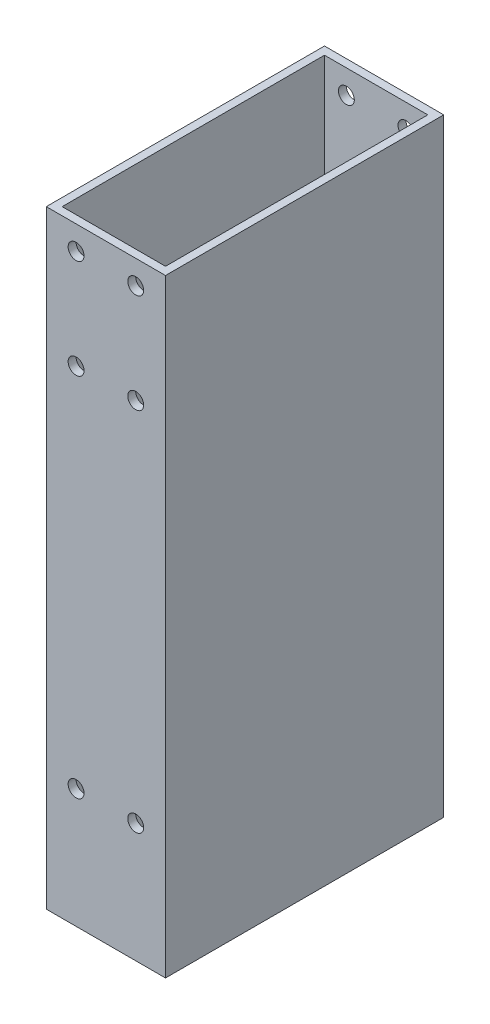
from build123d import *

# Parameters (mm, degrees)
SKETCH_1_W          = 30
SKETCH_1_H          = 766.14
SKETCH_1_R          = 2
EXTRUDE_2_DEPTH     = 70
SKETCH_2_W          = 26
SKETCH_2_H          = 66
CUT_EXTRUDE_3_DEPTH = 770.477419812
SKETCH_3_W          = 30
SKETCH_3_H          = 624.936750841
CUT_EXTRUDE_4_DEPTH = 390.70196933


with BuildPart() as part:
    # 草图1 → 凸台-拉伸2 (new body)
    with BuildSketch(Plane.XY):
        Rectangle(SKETCH_1_W, SKETCH_1_H)
        with Locations((-7.500000035, 377.074776011)):
            Circle(SKETCH_1_R, mode=Mode.SUBTRACT)
        with Locations((7.499999965, 377.074776011)):
            Circle(SKETCH_1_R, mode=Mode.SUBTRACT)
        with Locations((-7.500000035, 352.074776011)):
            Circle(SKETCH_1_R, mode=Mode.SUBTRACT)
        with Locations((7.499999965, 352.074776011)):
            Circle(SKETCH_1_R, mode=Mode.SUBTRACT)
        with Locations((7.499878903, 260)):
            Circle(SKETCH_1_R, mode=Mode.SUBTRACT)
        with Locations((-7.500121097, 260)):
            Circle(SKETCH_1_R, mode=Mode.SUBTRACT)
    extrude(amount=EXTRUDE_2_DEPTH)

    # 草图2 → 切除-拉伸3 (cut, through all)
    with BuildSketch(Plane.XZ.offset(383.07)):
        with Locations((0, 35)):
            Rectangle(SKETCH_2_W, SKETCH_2_H)
    extrude(amount=-CUT_EXTRUDE_3_DEPTH, mode=Mode.SUBTRACT)

    # 草图3 → 切除-拉伸4 (cut, through all)
    with BuildSketch(Plane.XY.offset(70)):
        with Locations((0, -82.468375421)):
            Rectangle(SKETCH_3_W, SKETCH_3_H)
    extrude(amount=-CUT_EXTRUDE_4_DEPTH, mode=Mode.SUBTRACT)


solid = part.part
